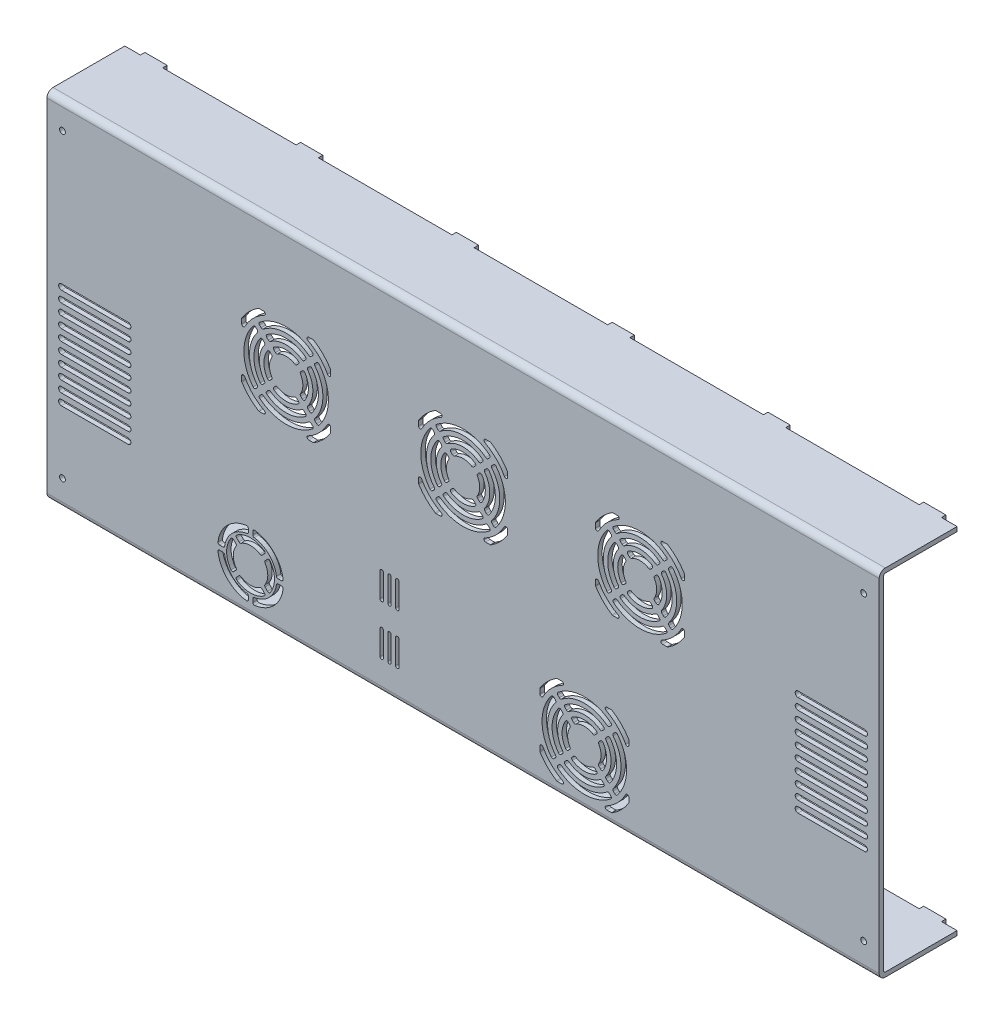
from build123d import *

# Parameters (mm, degrees)
SKETCH_1_W                         = 748
SKETCH_1_H                         = 310.5
EXTRUDE_1_DEPTH                    = 4
CUT_EXTRUDE_1_DEPTH                = 405.962421096
FILLET_3_R                         = 1.5
PATTERN_LINEAR_1_COUNT             = 2
PATTERN_LINEAR_1_PITCH             = 159
FILLET_3_OF_PATTERN_LINEAR_1_R     = 1.5
PATTERN_LINEAR_1_COL_COUNT         = 2
PATTERN_LINEAR_1_COL_PITCH         = 159
FILLET_3_OF_PATTERN_LINEAR_1_COL_R = 1.5
PATTERN_START                      = -1
PATTERN_SKETCH_1_DEPTH             = 6
CUT_EXTRUDE_2_DEPTH                = 405.962421096
FILLET_4_R                         = 1.5
CUT_EXTRUDE_3_DEPTH                = 405.962421096
CUT_EXTRUDE_4_DEPTH                = 405.962421096
SKETCH_2_W                         = 748
SKETCH_2_H                         = 70
EXTRUDE_2_DEPTH                    = 4
SKETCH_15_W                        = 20
SKETCH_15_H                        = 4
EXTRUDE_3_DEPTH                    = 4
FILLET_1_R                         = 1.5
FILLET_2_R                         = 5.5
FILLET_1_OF_MIRROR_1_R             = 1.5
FILLET_2_OF_MIRROR_1_R             = 5.5
SKETCH_8_W                         = 12
SKETCH_8_H                         = 10.5
SKETCH_8_W_2                       = 15.04
SKETCH_8_H_2                       = 2.1
CUT_EXTRUDE_5_DEPTH                = 4
SKETCH_9_R                         = 2.6
SKETCH_9_W                         = 33.8
SKETCH_9_H                         = 25.5
CUT_EXTRUDE_6_DEPTH                = 4
FILLET_5_R                         = 4.5
SKETCH_13_R                        = 2.6
CUT_EXTRUDE_8_DEPTH                = 414.173767923
SKETCH_17_R                        = 11.1
SKETCH_17_R_2                      = 1.6
CUT_EXTRUDE_9_DEPTH                = 4


with BuildPart() as part:
    # Эскиз1 → Бобышка-Вытянуть1 (new body)
    with BuildSketch(Plane.XY):
        Rectangle(SKETCH_1_W, SKETCH_1_H)
    extrude(amount=EXTRUDE_1_DEPTH)

    # Эскиз3 → Вырез-Вытянуть1 (cut, through all)
    with BuildSketch(Plane.XY.offset(4)):
        with BuildLine():
            Line((-28.579611351, 70.294077445), (-25.03523351, 66.749699604))
            ThreePointArc((-25.03523351, 66.749699604), (-33, 45.25), (-25.03523351, 23.750300396))
            Line((-25.03523351, 23.750300396), (-28.579611351, 20.205922555))
            ThreePointArc((-28.579611351, 20.205922555), (-38, 45.25), (-28.579611351, 70.294077445))
        make_face()
        with BuildLine():
            Line((-12.226017285, 36.559516621), (-15.798982153, 32.986551753))
            ThreePointArc((-15.798982153, 32.986551753), (-20, 45.25), (-15.798982153, 57.513448247))
            Line((-15.798982153, 57.513448247), (-12.226017285, 53.940483379))
            ThreePointArc((-12.226017285, 53.940483379), (-15, 45.25), (-12.226017285, 36.559516621))
        make_face()
        with BuildLine():
            Line((-18.646007383, 30.139526523), (-22.197524661, 26.588009245))
            ThreePointArc((-22.197524661, 26.588009245), (-29, 45.25), (-22.197524661, 63.911990755))
            Line((-22.197524661, 63.911990755), (-18.646007383, 60.360473477))
            ThreePointArc((-18.646007383, 60.360473477), (-24, 45.25), (-18.646007383, 30.139526523))
        make_face()
        with BuildLine():
            Line((-40, 20.572074641), (-40, 32.443751525))
            ThreePointArc((-40, 32.443751525), (-35.858145634, 23.382366573), (-29.69848481, 15.55151519))
            ThreePointArc((-29.69848481, 15.55151519), (-21.867633427, 9.391854366), (-12.806248475, 5.25))
            Line((-12.806248475, 5.25), (-24.677925359, 5.25))
            ThreePointArc((-24.677925359, 5.25), (-29.152923392, 8.383930808), (-33.234018716, 12.015981284))
            ThreePointArc((-33.234018716, 12.015981284), (-36.866069192, 16.097076608), (-40, 20.572074641))
        make_face()
        with BuildLine():
            Line((-40, 58.056248475), (-40, 69.927925359))
            ThreePointArc((-40, 69.927925359), (-36.866069192, 74.402923392), (-33.234018716, 78.484018716))
            ThreePointArc((-33.234018716, 78.484018716), (-29.152923392, 82.116069192), (-24.677925359, 85.25))
            Line((-24.677925359, 85.25), (-12.806248475, 85.25))
            ThreePointArc((-12.806248475, 85.25), (-21.867633427, 81.108145634), (-29.69848481, 74.94848481))
            ThreePointArc((-29.69848481, 74.94848481), (-35.858145634, 67.117633427), (-40, 58.056248475))
        make_face()
        with BuildLine():
            Line((25.044077445, 73.829611351), (21.499699604, 70.28523351))
            ThreePointArc((21.499699604, 70.28523351), (0, 78.25), (-21.499699604, 70.28523351))
            Line((-21.499699604, 70.28523351), (-25.044077445, 73.829611351))
            ThreePointArc((-25.044077445, 73.829611351), (0, 83.25), (25.044077445, 73.829611351))
        make_face()
        with BuildLine():
            Line((12.806248475, 85.25), (24.677925359, 85.25))
            ThreePointArc((24.677925359, 85.25), (29.152923392, 82.116069192), (33.234018716, 78.484018716))
            ThreePointArc((33.234018716, 78.484018716), (36.866069192, 74.402923392), (40, 69.927925359))
            Line((40, 69.927925359), (40, 58.056248475))
            ThreePointArc((40, 58.056248475), (35.858145634, 67.117633427), (29.69848481, 74.94848481))
            ThreePointArc((29.69848481, 74.94848481), (21.867633427, 81.108145634), (12.806248475, 85.25))
        make_face()
        with BuildLine():
            Line((-15.110473477, 63.896007383), (-18.661990755, 67.447524661))
            ThreePointArc((-18.661990755, 67.447524661), (0, 74.25), (18.661990755, 67.447524661))
            Line((18.661990755, 67.447524661), (15.110473477, 63.896007383))
            ThreePointArc((15.110473477, 63.896007383), (0, 69.25), (-15.110473477, 63.896007383))
        make_face()
        with BuildLine():
            Line((-8.690483379, 57.476017285), (-12.263448247, 61.048982153))
            ThreePointArc((-12.263448247, 61.048982153), (0, 65.25), (12.263448247, 61.048982153))
            Line((12.263448247, 61.048982153), (8.690483379, 57.476017285))
            ThreePointArc((8.690483379, 57.476017285), (0, 60.25), (-8.690483379, 57.476017285))
        make_face()
        with BuildLine():
            Line((28.579611351, 20.205922555), (25.03523351, 23.750300396))
            ThreePointArc((25.03523351, 23.750300396), (33, 45.25), (25.03523351, 66.749699604))
            Line((25.03523351, 66.749699604), (28.579611351, 70.294077445))
            ThreePointArc((28.579611351, 70.294077445), (38, 45.25), (28.579611351, 20.205922555))
        make_face()
        with BuildLine():
            Line((40, 32.443751525), (40, 20.572074641))
            ThreePointArc((40, 20.572074641), (36.866069192, 16.097076608), (33.234018716, 12.015981284))
            ThreePointArc((33.234018716, 12.015981284), (29.152923392, 8.383930808), (24.677925359, 5.25))
            Line((24.677925359, 5.25), (12.806248475, 5.25))
            ThreePointArc((12.806248475, 5.25), (21.867633427, 9.391854366), (29.69848481, 15.55151519))
            ThreePointArc((29.69848481, 15.55151519), (35.858145634, 23.382366573), (40, 32.443751525))
        make_face()
        with BuildLine():
            Line((18.646007383, 60.360473477), (22.197524661, 63.911990755))
            ThreePointArc((22.197524661, 63.911990755), (29, 45.25), (22.197524661, 26.588009245))
            Line((22.197524661, 26.588009245), (18.646007383, 30.139526523))
            ThreePointArc((18.646007383, 30.139526523), (24, 45.25), (18.646007383, 60.360473477))
        make_face()
        with BuildLine():
            Line((12.226017285, 53.940483379), (15.798982153, 57.513448247))
            ThreePointArc((15.798982153, 57.513448247), (20, 45.25), (15.798982153, 32.986551753))
            Line((15.798982153, 32.986551753), (12.226017285, 36.559516621))
            ThreePointArc((12.226017285, 36.559516621), (15, 45.25), (12.226017285, 53.940483379))
        make_face()
        with BuildLine():
            Line((-25.044077445, 16.670388649), (-21.499699604, 20.21476649))
            ThreePointArc((-21.499699604, 20.21476649), (0, 12.25), (21.499699604, 20.21476649))
            Line((21.499699604, 20.21476649), (25.044077445, 16.670388649))
            ThreePointArc((25.044077445, 16.670388649), (0, 7.25), (-25.044077445, 16.670388649))
        make_face()
        with BuildLine():
            Line((15.110473477, 26.603992617), (18.661990755, 23.052475339))
            ThreePointArc((18.661990755, 23.052475339), (0, 16.25), (-18.661990755, 23.052475339))
            Line((-18.661990755, 23.052475339), (-15.110473477, 26.603992617))
            ThreePointArc((-15.110473477, 26.603992617), (0, 21.25), (15.110473477, 26.603992617))
        make_face()
        with BuildLine():
            Line((8.690483379, 33.023982715), (12.263448247, 29.451017847))
            ThreePointArc((12.263448247, 29.451017847), (0, 25.25), (-12.263448247, 29.451017847))
            Line((-12.263448247, 29.451017847), (-8.690483379, 33.023982715))
            ThreePointArc((-8.690483379, 33.023982715), (0, 30.25), (8.690483379, 33.023982715))
        make_face()
    cut_extrude_1 = extrude(amount=-CUT_EXTRUDE_1_DEPTH, mode=Mode.SUBTRACT)

    # Скругление3
    fillet_3_edges = [part.edges().sort_by_distance(p)[0] for p in [
        (15.110473477, 63.896007383, 2),
        (-15.110473477, 63.896007383, 2),
        (-18.661990755, 67.447524661, 2),
        (18.661990755, 67.447524661, 2),
        (-40, 69.927925359, 2),
        (-24.677925359, 85.25, 2),
        (-12.806248475, 85.25, 2),
        (-40, 58.056248475, 2),
        (24.677925359, 85.25, 2),
        (40, 69.927925359, 2),
        (40, 58.056248475, 2),
        (12.806248475, 85.25, 2),
        (-40, 20.572074641, 2),
        (-40, 32.443751525, 2),
        (-12.806248475, 5.25, 2),
        (-24.677925359, 5.25, 2),
        (-8.690483379, 33.023982715, 2),
        (8.690483379, 33.023982715, 2),
        (12.263448247, 29.451017847, 2),
        (-12.263448247, 29.451017847, 2),
        (-15.110473477, 26.603992617, 2),
        (15.110473477, 26.603992617, 2),
        (18.661990755, 23.052475339, 2),
        (-18.661990755, 23.052475339, 2),
        (-21.499699604, 20.21476649, 2),
        (21.499699604, 20.21476649, 2),
        (25.044077445, 16.670388649, 2),
        (-25.044077445, 16.670388649, 2),
        (40, 20.572074641, 2),
        (24.677925359, 5.25, 2),
        (12.806248475, 5.25, 2),
        (40, 32.443751525, 2),
        (18.646007383, 30.139526523, 2),
        (18.646007383, 60.360473477, 2),
        (22.197524661, 63.911990755, 2),
        (22.197524661, 26.588009245, 2),
        (12.226017285, 36.559516621, 2),
        (12.226017285, 53.940483379, 2),
        (15.798982153, 57.513448247, 2),
        (15.798982153, 32.986551753, 2),
        (25.03523351, 23.750300396, 2),
        (25.03523351, 66.749699604, 2),
        (28.579611351, 70.294077445, 2),
        (28.579611351, 20.205922555, 2),
        (-18.646007383, 60.360473477, 2),
        (-18.646007383, 30.139526523, 2),
        (-22.197524661, 26.588009245, 2),
        (-22.197524661, 63.911990755, 2),
        (-12.226017285, 53.940483379, 2),
        (-12.226017285, 36.559516621, 2),
        (-15.798982153, 32.986551753, 2),
        (-15.798982153, 57.513448247, 2),
        (-25.03523351, 66.749699604, 2),
        (-25.03523351, 23.750300396, 2),
        (-28.579611351, 20.205922555, 2),
        (-28.579611351, 70.294077445, 2),
        (8.690483379, 57.476017285, 2),
        (-8.690483379, 57.476017285, 2),
        (-12.263448247, 61.048982153, 2),
        (12.263448247, 61.048982153, 2),
        (21.499699604, 70.28523351, 2),
        (-21.499699604, 70.28523351, 2),
        (-25.044077445, 73.829611351, 2),
        (25.044077445, 73.829611351, 2),
    ]]
    fillet(fillet_3_edges, radius=FILLET_3_R)

    # Линейный массив1: Вырез-Вытянуть1 ×2
    with Locations(*[(i * PATTERN_LINEAR_1_PITCH, 0, 0) for i in range(1, PATTERN_LINEAR_1_COUNT)]):
        add(cut_extrude_1, mode=Mode.SUBTRACT)

    # Скругление3 of Линейный массив1
    fillet_3_of_pattern_linear_1_edges = [part.edges().sort_by_distance(p)[0] for p in [
        (174.110473477, 63.896007383, 2),
        (143.889526523, 63.896007383, 2),
        (140.338009245, 67.447524661, 2),
        (177.661990755, 67.447524661, 2),
        (119, 69.927925359, 2),
        (134.322074641, 85.25, 2),
        (146.193751525, 85.25, 2),
        (119, 58.056248475, 2),
        (183.677925359, 85.25, 2),
        (199, 69.927925359, 2),
        (199, 58.056248475, 2),
        (171.806248475, 85.25, 2),
        (119, 20.572074641, 2),
        (119, 32.443751525, 2),
        (146.193751525, 5.25, 2),
        (134.322074641, 5.25, 2),
        (150.309516621, 33.023982715, 2),
        (167.690483379, 33.023982715, 2),
        (171.263448247, 29.451017847, 2),
        (146.736551753, 29.451017847, 2),
        (143.889526523, 26.603992617, 2),
        (174.110473477, 26.603992617, 2),
        (177.661990755, 23.052475339, 2),
        (140.338009245, 23.052475339, 2),
        (137.500300396, 20.21476649, 2),
        (180.499699604, 20.21476649, 2),
        (184.044077445, 16.670388649, 2),
        (133.955922555, 16.670388649, 2),
        (199, 20.572074641, 2),
        (183.677925359, 5.25, 2),
        (171.806248475, 5.25, 2),
        (199, 32.443751525, 2),
        (177.646007383, 30.139526523, 2),
        (177.646007383, 60.360473477, 2),
        (181.197524661, 63.911990755, 2),
        (181.197524661, 26.588009245, 2),
        (171.226017285, 36.559516621, 2),
        (171.226017285, 53.940483379, 2),
        (174.798982153, 57.513448247, 2),
        (174.798982153, 32.986551753, 2),
        (184.03523351, 23.750300396, 2),
        (184.03523351, 66.749699604, 2),
        (187.579611351, 70.294077445, 2),
        (187.579611351, 20.205922555, 2),
        (140.353992617, 60.360473477, 2),
        (140.353992617, 30.139526523, 2),
        (136.802475339, 26.588009245, 2),
        (136.802475339, 63.911990755, 2),
        (146.773982715, 53.940483379, 2),
        (146.773982715, 36.559516621, 2),
        (143.201017847, 32.986551753, 2),
        (143.201017847, 57.513448247, 2),
        (133.96476649, 66.749699604, 2),
        (133.96476649, 23.750300396, 2),
        (130.420388649, 20.205922555, 2),
        (130.420388649, 70.294077445, 2),
        (167.690483379, 57.476017285, 2),
        (150.309516621, 57.476017285, 2),
        (146.736551753, 61.048982153, 2),
        (171.263448247, 61.048982153, 2),
        (180.499699604, 70.28523351, 2),
        (137.500300396, 70.28523351, 2),
        (133.955922555, 73.829611351, 2),
        (184.044077445, 73.829611351, 2),
    ]]
    fillet(fillet_3_of_pattern_linear_1_edges, radius=FILLET_3_OF_PATTERN_LINEAR_1_R)

    # Линейный массив1 col: Вырез-Вытянуть1 ×2
    with Locations(*[(-i * PATTERN_LINEAR_1_COL_PITCH, 0, 0) for i in range(1, PATTERN_LINEAR_1_COL_COUNT)]):
        add(cut_extrude_1, mode=Mode.SUBTRACT)

    # Скругление3 of Линейный массив1 col
    fillet_3_of_pattern_linear_1_col_edges = [part.edges().sort_by_distance(p)[0] for p in [
        (-143.889526523, 63.896007383, 2),
        (-174.110473477, 63.896007383, 2),
        (-177.661990755, 67.447524661, 2),
        (-140.338009245, 67.447524661, 2),
        (-199, 69.927925359, 2),
        (-183.677925359, 85.25, 2),
        (-171.806248475, 85.25, 2),
        (-199, 58.056248475, 2),
        (-134.322074641, 85.25, 2),
        (-119, 69.927925359, 2),
        (-119, 58.056248475, 2),
        (-146.193751525, 85.25, 2),
        (-199, 20.572074641, 2),
        (-199, 32.443751525, 2),
        (-171.806248475, 5.25, 2),
        (-183.677925359, 5.25, 2),
        (-167.690483379, 33.023982715, 2),
        (-150.309516621, 33.023982715, 2),
        (-146.736551753, 29.451017847, 2),
        (-171.263448247, 29.451017847, 2),
        (-174.110473477, 26.603992617, 2),
        (-143.889526523, 26.603992617, 2),
        (-140.338009245, 23.052475339, 2),
        (-177.661990755, 23.052475339, 2),
        (-180.499699604, 20.21476649, 2),
        (-137.500300396, 20.21476649, 2),
        (-133.955922555, 16.670388649, 2),
        (-184.044077445, 16.670388649, 2),
        (-119, 20.572074641, 2),
        (-134.322074641, 5.25, 2),
        (-146.193751525, 5.25, 2),
        (-119, 32.443751525, 2),
        (-140.353992617, 30.139526523, 2),
        (-140.353992617, 60.360473477, 2),
        (-136.802475339, 63.911990755, 2),
        (-136.802475339, 26.588009245, 2),
        (-146.773982715, 36.559516621, 2),
        (-146.773982715, 53.940483379, 2),
        (-143.201017847, 57.513448247, 2),
        (-143.201017847, 32.986551753, 2),
        (-133.96476649, 23.750300396, 2),
        (-133.96476649, 66.749699604, 2),
        (-130.420388649, 70.294077445, 2),
        (-130.420388649, 20.205922555, 2),
        (-177.646007383, 60.360473477, 2),
        (-177.646007383, 30.139526523, 2),
        (-181.197524661, 26.588009245, 2),
        (-181.197524661, 63.911990755, 2),
        (-171.226017285, 53.940483379, 2),
        (-171.226017285, 36.559516621, 2),
        (-174.798982153, 32.986551753, 2),
        (-174.798982153, 57.513448247, 2),
        (-184.03523351, 66.749699604, 2),
        (-184.03523351, 23.750300396, 2),
        (-187.579611351, 20.205922555, 2),
        (-187.579611351, 70.294077445, 2),
        (-150.309516621, 57.476017285, 2),
        (-167.690483379, 57.476017285, 2),
        (-171.263448247, 61.048982153, 2),
        (-146.736551753, 61.048982153, 2),
        (-137.500300396, 70.28523351, 2),
        (-180.499699604, 70.28523351, 2),
        (-184.044077445, 73.829611351, 2),
        (-133.955922555, 73.829611351, 2),
    ]]
    fillet(fillet_3_of_pattern_linear_1_col_edges, radius=FILLET_3_OF_PATTERN_LINEAR_1_COL_R)

    # Эскиз-Массив1: read off the stored shape, not the designer's step
    # Эскиз-Массив1 outline → Эскиз-Массив1 (cut)
    with BuildSketch(Plane.XY.offset(PATTERN_START)):
        with BuildLine():
            ThreePointArc((89.577476759, -122.848425124), (85, -108.75), (89.577476759, -94.651574876))
            ThreePointArc((89.577476759, -94.651574876), (89.858919505, -93.652410443), (89.424229229, -92.709763134))
            Line((89.424229229, -92.709763134), (87.993600039, -91.279133945))
            ThreePointArc((87.993600039, -91.279133945), (86.823557749, -90.843787582), (85.729282042, -91.444691978))
            ThreePointArc((85.729282042, -91.444691978), (80, -108.75), (85.729282042, -126.055308022))
            ThreePointArc((85.729282042, -126.055308022), (86.823557749, -126.656212418), (87.993600039, -126.220866055))
            Line((87.993600039, -126.220866055), (89.424229229, -124.790236866))
            ThreePointArc((89.424229229, -124.790236866), (89.858919505, -123.847589557), (89.577476759, -122.848425124))
        make_face()
        with BuildLine():
            ThreePointArc((128.422523241, -94.651574876), (133, -108.75), (128.422523241, -122.848425124))
            ThreePointArc((128.422523241, -122.848425124), (128.141080495, -123.847589557), (128.575770771, -124.790236866))
            Line((128.575770771, -124.790236866), (130.006399961, -126.220866055))
            ThreePointArc((130.006399961, -126.220866055), (131.176442251, -126.656212418), (132.270717958, -126.055308022))
            ThreePointArc((132.270717958, -126.055308022), (138, -108.75), (132.270717958, -91.444691978))
            ThreePointArc((132.270717958, -91.444691978), (131.176442251, -90.843787582), (130.006399961, -91.279133945))
            Line((130.006399961, -91.279133945), (128.575770771, -92.709763134))
            ThreePointArc((128.575770771, -92.709763134), (128.141080495, -93.652410443), (128.422523241, -94.651574876))
        make_face()
        with BuildLine():
            ThreePointArc((123.098425124, -128.172523241), (109, -132.75), (94.901574876, -128.172523241))
            ThreePointArc((94.901574876, -128.172523241), (93.902410443, -127.891080495), (92.959763134, -128.325770771))
            Line((92.959763134, -128.325770771), (91.529133945, -129.756399961))
            ThreePointArc((91.529133945, -129.756399961), (91.093787582, -130.926442251), (91.694691978, -132.020717958))
            ThreePointArc((91.694691978, -132.020717958), (109, -137.75), (126.305308022, -132.020717958))
            ThreePointArc((126.305308022, -132.020717958), (126.906212418, -130.926442251), (126.470866055, -129.756399961))
            Line((126.470866055, -129.756399961), (125.040236866, -128.325770771))
            ThreePointArc((125.040236866, -128.325770771), (124.097589557, -127.891080495), (123.098425124, -128.172523241))
        make_face()
        with BuildLine():
            ThreePointArc((94.901574876, -89.327476759), (109, -84.75), (123.098425124, -89.327476759))
            ThreePointArc((123.098425124, -89.327476759), (124.097589557, -89.608919505), (125.040236866, -89.174229229))
            Line((125.040236866, -89.174229229), (126.470866055, -87.743600039))
            ThreePointArc((126.470866055, -87.743600039), (126.906212418, -86.573557749), (126.305308022, -85.479282042))
            ThreePointArc((126.305308022, -85.479282042), (109, -79.75), (91.694691978, -85.479282042))
            ThreePointArc((91.694691978, -85.479282042), (91.093787582, -86.573557749), (91.529133945, -87.743600039))
            Line((91.529133945, -87.743600039), (92.959763134, -89.174229229))
            ThreePointArc((92.959763134, -89.174229229), (93.902410443, -89.608919505), (94.901574876, -89.327476759))
        make_face()
        with BuildLine():
            ThreePointArc((129.4717033, -82.867392635), (130.489338771, -83.18837934), (131.46289544, -82.751570654))
            Line((131.46289544, -82.751570654), (132.886180112, -81.328285982))
            ThreePointArc((132.886180112, -81.328285982), (133.323259605, -80.185309989), (132.763555006, -79.097117282))
            ThreePointArc((132.763555006, -79.097117282), (109, -70.75), (85.236444994, -79.097117282))
            ThreePointArc((85.236444994, -79.097117282), (84.676740395, -80.185309989), (85.113819888, -81.328285982))
            Line((85.113819888, -81.328285982), (86.53710456, -82.751570654))
            ThreePointArc((86.53710456, -82.751570654), (87.510661229, -83.18837934), (88.5282967, -82.867392635))
            ThreePointArc((88.5282967, -82.867392635), (109, -75.75), (129.4717033, -82.867392635))
        make_face()
        with BuildLine():
            ThreePointArc((116.718912998, -95.88849223), (117.673993732, -96.091113306), (118.55146447, -95.663001624))
            Line((118.55146447, -95.663001624), (120.004272821, -94.210193273))
            ThreePointArc((120.004272821, -94.210193273), (120.43471583, -92.986403382), (119.749851513, -91.884630379))
            ThreePointArc((119.749851513, -91.884630379), (109, -88.75), (98.250148487, -91.884630379))
            ThreePointArc((98.250148487, -91.884630379), (97.56528417, -92.986403382), (97.995727179, -94.210193273))
            Line((97.995727179, -94.210193273), (99.44853553, -95.663001624))
            ThreePointArc((99.44853553, -95.663001624), (100.326006268, -96.091113306), (101.281087002, -95.88849223))
            ThreePointArc((101.281087002, -95.88849223), (109, -93.75), (116.718912998, -95.88849223))
        make_face()
        with BuildLine():
            ThreePointArc((79.347117282, -132.513555006), (80.435309989, -133.073259605), (81.578285982, -132.636180112))
            Line((81.578285982, -132.636180112), (83.001570654, -131.21289544))
            ThreePointArc((83.001570654, -131.21289544), (83.43837934, -130.239338771), (83.117392635, -129.2217033))
            ThreePointArc((83.117392635, -129.2217033), (76, -108.75), (83.117392635, -88.2782967))
            ThreePointArc((83.117392635, -88.2782967), (83.43837934, -87.260661229), (83.001570654, -86.28710456))
            Line((83.001570654, -86.28710456), (81.578285982, -84.863819888))
            ThreePointArc((81.578285982, -84.863819888), (80.435309989, -84.426740395), (79.347117282, -84.986444994))
            ThreePointArc((79.347117282, -84.986444994), (71, -108.75), (79.347117282, -132.513555006))
        make_face()
        with BuildLine():
            ThreePointArc((92.134630379, -119.499851513), (93.236403382, -120.18471583), (94.460193273, -119.754272821))
            Line((94.460193273, -119.754272821), (95.913001624, -118.30146447))
            ThreePointArc((95.913001624, -118.30146447), (96.341113306, -117.423993732), (96.13849223, -116.468912998))
            ThreePointArc((96.13849223, -116.468912998), (94, -108.75), (96.13849223, -101.031087002))
            ThreePointArc((96.13849223, -101.031087002), (96.341113306, -100.076006268), (95.913001624, -99.19853553))
            Line((95.913001624, -99.19853553), (94.460193273, -97.745727179))
            ThreePointArc((94.460193273, -97.745727179), (93.236403382, -97.31528417), (92.134630379, -98.000148487))
            ThreePointArc((92.134630379, -98.000148487), (89, -108.75), (92.134630379, -119.499851513))
        make_face()
        with BuildLine():
            ThreePointArc((132.763555006, -138.402882718), (133.323259605, -137.314690011), (132.886180112, -136.171714018))
            Line((132.886180112, -136.171714018), (131.46289544, -134.748429346))
            ThreePointArc((131.46289544, -134.748429346), (130.489338771, -134.31162066), (129.4717033, -134.632607365))
            ThreePointArc((129.4717033, -134.632607365), (109, -141.75), (88.5282967, -134.632607365))
            ThreePointArc((88.5282967, -134.632607365), (87.510661229, -134.31162066), (86.53710456, -134.748429346))
            Line((86.53710456, -134.748429346), (85.113819888, -136.171714018))
            ThreePointArc((85.113819888, -136.171714018), (84.676740395, -137.314690011), (85.236444994, -138.402882718))
            ThreePointArc((85.236444994, -138.402882718), (109, -146.75), (132.763555006, -138.402882718))
        make_face()
        with BuildLine():
            ThreePointArc((119.749851513, -125.615369621), (120.43471583, -124.513596618), (120.004272821, -123.289806727))
            Line((120.004272821, -123.289806727), (118.55146447, -121.836998376))
            ThreePointArc((118.55146447, -121.836998376), (117.673993732, -121.408886694), (116.718912998, -121.61150777))
            ThreePointArc((116.718912998, -121.61150777), (109, -123.75), (101.281087002, -121.61150777))
            ThreePointArc((101.281087002, -121.61150777), (100.326006268, -121.408886694), (99.44853553, -121.836998376))
            Line((99.44853553, -121.836998376), (97.995727179, -123.289806727))
            ThreePointArc((97.995727179, -123.289806727), (97.56528417, -124.513596618), (98.250148487, -125.615369621))
            ThreePointArc((98.250148487, -125.615369621), (109, -128.75), (119.749851513, -125.615369621))
        make_face()
        with BuildLine():
            ThreePointArc((134.882607365, -88.2782967), (142, -108.75), (134.882607365, -129.2217033))
            ThreePointArc((134.882607365, -129.2217033), (134.56162066, -130.239338771), (134.998429346, -131.21289544))
            Line((134.998429346, -131.21289544), (136.421714018, -132.636180112))
            ThreePointArc((136.421714018, -132.636180112), (137.564690011, -133.073259605), (138.652882718, -132.513555006))
            ThreePointArc((138.652882718, -132.513555006), (147, -108.75), (138.652882718, -84.986444994))
            ThreePointArc((138.652882718, -84.986444994), (137.564690011, -84.426740395), (136.421714018, -84.863819888))
            Line((136.421714018, -84.863819888), (134.998429346, -86.28710456))
            ThreePointArc((134.998429346, -86.28710456), (134.56162066, -87.260661229), (134.882607365, -88.2782967))
        make_face()
        with BuildLine():
            ThreePointArc((125.865369621, -98.000148487), (124.763596618, -97.31528417), (123.539806727, -97.745727179))
            Line((123.539806727, -97.745727179), (122.086998376, -99.19853553))
            ThreePointArc((122.086998376, -99.19853553), (121.658886694, -100.076006268), (121.86150777, -101.031087002))
            ThreePointArc((121.86150777, -101.031087002), (124, -108.75), (121.86150777, -116.468912998))
            ThreePointArc((121.86150777, -116.468912998), (121.658886694, -117.423993732), (122.086998376, -118.30146447))
            Line((122.086998376, -118.30146447), (123.539806727, -119.754272821))
            ThreePointArc((123.539806727, -119.754272821), (124.763596618, -120.18471583), (125.865369621, -119.499851513))
            ThreePointArc((125.865369621, -119.499851513), (129, -108.75), (125.865369621, -98.000148487))
        make_face()
        with BuildLine():
            ThreePointArc((133.248711306, -148.75), (133.664736453, -148.691153384), (134.048119371, -148.519230769))
            ThreePointArc((134.048119371, -148.519230769), (142.234018716, -141.984018716), (148.769230769, -133.798119371))
            ThreePointArc((148.769230769, -133.798119371), (148.941153384, -133.414736453), (149, -132.998711306))
            Line((149, -132.998711306), (149, -128.998456731))
            ThreePointArc((149, -128.998456731), (147.859597476, -127.542197944), (146.172413793, -128.300234085))
            ThreePointArc((146.172413793, -128.300234085), (138.69848481, -138.44848481), (128.550234085, -145.922413793))
            ThreePointArc((128.550234085, -145.922413793), (127.792197944, -147.609597476), (129.248456731, -148.75))
            Line((129.248456731, -148.75), (133.248711306, -148.75))
        make_face()
        with BuildLine():
            ThreePointArc((69, -132.998711306), (69.058846616, -133.414736453), (69.230769231, -133.798119371))
            ThreePointArc((69.230769231, -133.798119371), (75.765981284, -141.984018716), (83.951880629, -148.519230769))
            ThreePointArc((83.951880629, -148.519230769), (84.335263547, -148.691153384), (84.751288694, -148.75))
            Line((84.751288694, -148.75), (88.751543269, -148.75))
            ThreePointArc((88.751543269, -148.75), (90.207802056, -147.609597476), (89.449765915, -145.922413793))
            ThreePointArc((89.449765915, -145.922413793), (79.30151519, -138.44848481), (71.827586207, -128.300234085))
            ThreePointArc((71.827586207, -128.300234085), (70.140402524, -127.542197944), (69, -128.998456731))
            Line((69, -128.998456731), (69, -132.998711306))
        make_face()
        with BuildLine():
            ThreePointArc((149, -84.501288694), (148.941153384, -84.085263547), (148.769230769, -83.701880629))
            ThreePointArc((148.769230769, -83.701880629), (142.234018716, -75.515981284), (134.048119371, -68.980769231))
            ThreePointArc((134.048119371, -68.980769231), (133.664736453, -68.808846616), (133.248711306, -68.75))
            Line((133.248711306, -68.75), (129.248456731, -68.75))
            ThreePointArc((129.248456731, -68.75), (127.792197944, -69.890402524), (128.550234085, -71.577586207))
            ThreePointArc((128.550234085, -71.577586207), (138.69848481, -79.05151519), (146.172413793, -89.199765915))
            ThreePointArc((146.172413793, -89.199765915), (147.859597476, -89.957802056), (149, -88.501543269))
            Line((149, -88.501543269), (149, -84.501288694))
        make_face()
        with BuildLine():
            ThreePointArc((84.751288694, -68.75), (84.335263547, -68.808846616), (83.951880629, -68.980769231))
            ThreePointArc((83.951880629, -68.980769231), (75.765981284, -75.515981284), (69.230769231, -83.701880629))
            ThreePointArc((69.230769231, -83.701880629), (69.058846616, -84.085263547), (69, -84.501288694))
            Line((69, -84.501288694), (69, -88.501543269))
            ThreePointArc((69, -88.501543269), (70.140402524, -89.957802056), (71.827586207, -89.199765915))
            ThreePointArc((71.827586207, -89.199765915), (79.30151519, -79.05151519), (89.449765915, -71.577586207))
            ThreePointArc((89.449765915, -71.577586207), (90.207802056, -69.890402524), (88.751543269, -68.75))
            Line((88.751543269, -68.75), (84.751288694, -68.75))
        make_face()
    extrude(amount=PATTERN_SKETCH_1_DEPTH, mode=Mode.SUBTRACT)

    # Эскиз4 → Вырез-Вытянуть2 (cut, through all)
    with BuildSketch(Plane.XY.offset(4)):
        with BuildLine():
            Line((-204.722661941, -135.101089066), (-200.454318997, -130.832746122))
            ThreePointArc((-200.454318997, -130.832746122), (-191, -134.05), (-181.545681003, -130.832746122))
            Line((-181.545681003, -130.832746122), (-177.277338059, -135.101089066))
            ThreePointArc((-177.277338059, -135.101089066), (-191, -140.05), (-204.722661941, -135.101089066))
        make_face()
        with BuildLine():
            Line((-189, -147.982125306), (-189, -141.964738948))
            ThreePointArc((-189, -141.964738948), (-174.382990642, -135.167009358), (-167.585261052, -120.55))
            Line((-167.585261052, -120.55), (-161.567874694, -120.55))
            ThreePointArc((-161.567874694, -120.55), (-170.140349955, -139.409650045), (-189, -147.982125306))
        make_face()
        with BuildLine():
            Line((-207.551089066, -132.272661941), (-203.282746122, -128.004318997))
            ThreePointArc((-203.282746122, -128.004318997), (-206.5, -118.55), (-203.282746122, -109.095681003))
            Line((-203.282746122, -109.095681003), (-207.551089066, -104.827338059))
            ThreePointArc((-207.551089066, -104.827338059), (-212.5, -118.55), (-207.551089066, -132.272661941))
        make_face()
        with BuildLine():
            Line((-193, -141.964738948), (-193, -147.982125306))
            ThreePointArc((-193, -147.982125306), (-211.859650045, -139.409650045), (-220.432125306, -120.55))
            Line((-220.432125306, -120.55), (-214.414738948, -120.55))
            ThreePointArc((-214.414738948, -120.55), (-207.617009358, -135.167009358), (-193, -141.964738948))
        make_face()
        with BuildLine():
            Line((-204.722661941, -101.998910934), (-200.454318997, -106.267253878))
            ThreePointArc((-200.454318997, -106.267253878), (-191, -103.05), (-181.545681003, -106.267253878))
            Line((-181.545681003, -106.267253878), (-177.277338059, -101.998910934))
            ThreePointArc((-177.277338059, -101.998910934), (-191, -97.05), (-204.722661941, -101.998910934))
        make_face()
        with BuildLine():
            Line((-214.414738948, -116.55), (-220.432125306, -116.55))
            ThreePointArc((-220.432125306, -116.55), (-211.859650045, -97.690349955), (-193, -89.117874694))
            Line((-193, -89.117874694), (-193, -95.135261052))
            ThreePointArc((-193, -95.135261052), (-207.617009358, -101.932990642), (-214.414738948, -116.55))
        make_face()
        with BuildLine():
            Line((-174.448910934, -104.827338059), (-178.717253878, -109.095681003))
            ThreePointArc((-178.717253878, -109.095681003), (-175.5, -118.55), (-178.717253878, -128.004318997))
            Line((-178.717253878, -128.004318997), (-174.448910934, -132.272661941))
            ThreePointArc((-174.448910934, -132.272661941), (-169.5, -118.55), (-174.448910934, -104.827338059))
        make_face()
        with BuildLine():
            Line((-189, -95.135261052), (-189, -89.117874694))
            ThreePointArc((-189, -89.117874694), (-170.140349955, -97.690349955), (-161.567874694, -116.55))
            Line((-161.567874694, -116.55), (-167.585261052, -116.55))
            ThreePointArc((-167.585261052, -116.55), (-174.382990642, -101.932990642), (-189, -95.135261052))
        make_face()
    extrude(amount=-CUT_EXTRUDE_2_DEPTH, mode=Mode.SUBTRACT)

    # Скругление4
    fillet_4_edges = [part.edges().sort_by_distance(p)[0] for p in [
        (-207.551089066, -132.272661941, 2),
        (-207.551089066, -104.827338059, 2),
        (-203.282746122, -109.095681003, 2),
        (-203.282746122, -128.004318997, 2),
        (-193, -95.135261052, 2),
        (-214.414738948, -116.55, 2),
        (-220.432125306, -116.55, 2),
        (-193, -89.117874694, 2),
        (-177.277338059, -135.101089066, 2),
        (-204.722661941, -135.101089066, 2),
        (-200.454318997, -130.832746122, 2),
        (-181.545681003, -130.832746122, 2),
        (-214.414738948, -120.55, 2),
        (-193, -141.964738948, 2),
        (-193, -147.982125306, 2),
        (-220.432125306, -120.55, 2),
        (-174.448910934, -104.827338059, 2),
        (-174.448910934, -132.272661941, 2),
        (-178.717253878, -128.004318997, 2),
        (-178.717253878, -109.095681003, 2),
        (-204.722661941, -101.998910934, 2),
        (-177.277338059, -101.998910934, 2),
        (-181.545681003, -106.267253878, 2),
        (-200.454318997, -106.267253878, 2),
        (-167.585261052, -116.55, 2),
        (-189, -95.135261052, 2),
        (-189, -89.117874694, 2),
        (-161.567874694, -116.55, 2),
        (-189, -141.964738948, 2),
        (-167.585261052, -120.55, 2),
        (-161.567874694, -120.55, 2),
        (-189, -147.982125306, 2),
    ]]
    fillet(fillet_4_edges, radius=FILLET_4_R)

    # Эскиз5 → Вырез-Вытянуть3 (cut, through all)
    with BuildSketch(Plane.XY.offset(4)):
        with BuildLine():
            Line((-64.6, -131.25), (-64.6, -109.25))
            ThreePointArc((-64.6, -109.25), (-66.1, -107.75), (-67.6, -109.25))
            Line((-67.6, -109.25), (-67.6, -131.25))
            ThreePointArc((-67.6, -131.25), (-66.1, -132.75), (-64.6, -131.25))
        make_face()
        with BuildLine():
            Line((-57.6, -131.25), (-57.6, -109.25))
            ThreePointArc((-57.6, -109.25), (-59.1, -107.75), (-60.6, -109.25))
            Line((-60.6, -109.25), (-60.6, -131.25))
            ThreePointArc((-60.6, -131.25), (-59.1, -132.75), (-57.6, -131.25))
        make_face()
        with BuildLine():
            Line((-64.6, -86.25), (-64.6, -64.25))
            ThreePointArc((-64.6, -64.25), (-66.1, -62.75), (-67.6, -64.25))
            Line((-67.6, -64.25), (-67.6, -86.25))
            ThreePointArc((-67.6, -86.25), (-66.1, -87.75), (-64.6, -86.25))
        make_face()
        with BuildLine():
            Line((-57.6, -86.25), (-57.6, -64.25))
            ThreePointArc((-57.6, -64.25), (-59.1, -62.75), (-60.6, -64.25))
            Line((-60.6, -64.25), (-60.6, -86.25))
            ThreePointArc((-60.6, -86.25), (-59.1, -87.75), (-57.6, -86.25))
        make_face()
        with BuildLine():
            Line((-71.6, -86.25), (-71.6, -64.25))
            ThreePointArc((-71.6, -64.25), (-73.1, -62.75), (-74.6, -64.25))
            Line((-74.6, -64.25), (-74.6, -86.25))
            ThreePointArc((-74.6, -86.25), (-73.1, -87.75), (-71.6, -86.25))
        make_face()
        with BuildLine():
            Line((-74.6, -109.25), (-74.6, -131.25))
            ThreePointArc((-74.6, -131.25), (-73.1, -132.75), (-71.6, -131.25))
            Line((-71.6, -131.25), (-71.6, -109.25))
            ThreePointArc((-71.6, -109.25), (-73.1, -107.75), (-74.6, -109.25))
        make_face()
    extrude(amount=-CUT_EXTRUDE_3_DEPTH, mode=Mode.SUBTRACT)

    # Эскиз7 → Вырез-Вытянуть4 (cut, through all)
    with BuildSketch(Plane.XY.offset(4)):
        with BuildLine():
            Line((301, -25.25), (361, -25.25))
            ThreePointArc((361, -25.25), (363.5, -22.75), (361, -20.25))
            Line((361, -20.25), (301, -20.25))
            ThreePointArc((301, -20.25), (298.5, -22.75), (301, -25.25))
        make_face()
        with BuildLine():
            Line((301, -35.25), (361, -35.25))
            ThreePointArc((361, -35.25), (363.5, -32.75), (361, -30.25))
            Line((361, -30.25), (301, -30.25))
            ThreePointArc((301, -30.25), (298.5, -32.75), (301, -35.25))
        make_face()
        with BuildLine():
            Line((301, -45.25), (361, -45.25))
            ThreePointArc((361, -45.25), (363.5, -42.75), (361, -40.25))
            Line((361, -40.25), (301, -40.25))
            ThreePointArc((301, -40.25), (298.5, -42.75), (301, -45.25))
        make_face()
        with BuildLine():
            Line((361, 29.75), (301, 29.75))
            ThreePointArc((301, 29.75), (298.5, 27.25), (301, 24.75))
            Line((301, 24.75), (361, 24.75))
            ThreePointArc((361, 24.75), (363.5, 27.25), (361, 29.75))
        make_face()
        with BuildLine():
            Line((301, 14.75), (361, 14.75))
            ThreePointArc((361, 14.75), (363.5, 17.25), (361, 19.75))
            Line((361, 19.75), (301, 19.75))
            ThreePointArc((301, 19.75), (298.5, 17.25), (301, 14.75))
        make_face()
        with BuildLine():
            Line((301, 4.75), (361, 4.75))
            ThreePointArc((361, 4.75), (363.5, 7.25), (361, 9.75))
            Line((361, 9.75), (301, 9.75))
            ThreePointArc((301, 9.75), (298.5, 7.25), (301, 4.75))
        make_face()
        with BuildLine():
            Line((301, -5.25), (361, -5.25))
            ThreePointArc((361, -5.25), (363.5, -2.75), (361, -0.25))
            Line((361, -0.25), (301, -0.25))
            ThreePointArc((301, -0.25), (298.5, -2.75), (301, -5.25))
        make_face()
        with BuildLine():
            Line((301, -15.25), (361, -15.25))
            ThreePointArc((361, -15.25), (363.5, -12.75), (361, -10.25))
            Line((361, -10.25), (301, -10.25))
            ThreePointArc((301, -10.25), (298.5, -12.75), (301, -15.25))
        make_face()
        with BuildLine():
            Line((-301, 15.75), (-361, 15.75))
            ThreePointArc((-361, 15.75), (-363.5, 13.25), (-361, 10.75))
            Line((-361, 10.75), (-301, 10.75))
            ThreePointArc((-301, 10.75), (-298.5, 13.25), (-301, 15.75))
        make_face()
        with BuildLine():
            Line((-301, 5.75), (-361, 5.75))
            ThreePointArc((-361, 5.75), (-363.5, 3.25), (-361, 0.75))
            Line((-361, 0.75), (-301, 0.75))
            ThreePointArc((-301, 0.75), (-298.5, 3.25), (-301, 5.75))
        make_face()
        with BuildLine():
            Line((-301, -4.25), (-361, -4.25))
            ThreePointArc((-361, -4.25), (-363.5, -6.75), (-361, -9.25))
            Line((-361, -9.25), (-301, -9.25))
            ThreePointArc((-301, -9.25), (-298.5, -6.75), (-301, -4.25))
        make_face()
        with BuildLine():
            Line((-301, -14.25), (-361, -14.25))
            ThreePointArc((-361, -14.25), (-363.5, -16.75), (-361, -19.25))
            Line((-361, -19.25), (-301, -19.25))
            ThreePointArc((-301, -19.25), (-298.5, -16.75), (-301, -14.25))
        make_face()
        with BuildLine():
            Line((-301, -24.25), (-361, -24.25))
            ThreePointArc((-361, -24.25), (-363.5, -26.75), (-361, -29.25))
            Line((-361, -29.25), (-301, -29.25))
            ThreePointArc((-301, -29.25), (-298.5, -26.75), (-301, -24.25))
        make_face()
        with BuildLine():
            Line((-301, -34.25), (-361, -34.25))
            ThreePointArc((-361, -34.25), (-363.5, -36.75), (-361, -39.25))
            Line((-361, -39.25), (-301, -39.25))
            ThreePointArc((-301, -39.25), (-298.5, -36.75), (-301, -34.25))
        make_face()
        with BuildLine():
            Line((-301, -44.25), (-361, -44.25))
            ThreePointArc((-361, -44.25), (-363.5, -46.75), (-361, -49.25))
            Line((-361, -49.25), (-301, -49.25))
            ThreePointArc((-301, -49.25), (-298.5, -46.75), (-301, -44.25))
        make_face()
        with BuildLine():
            Line((-301, -54.25), (-361, -54.25))
            ThreePointArc((-361, -54.25), (-363.5, -56.75), (-361, -59.25))
            Line((-361, -59.25), (-301, -59.25))
            ThreePointArc((-301, -59.25), (-298.5, -56.75), (-301, -54.25))
        make_face()
        with BuildLine():
            Line((-301, -64.25), (-361, -64.25))
            ThreePointArc((-361, -64.25), (-363.5, -66.75), (-361, -69.25))
            Line((-361, -69.25), (-301, -69.25))
            ThreePointArc((-301, -69.25), (-298.5, -66.75), (-301, -64.25))
        make_face()
        with BuildLine():
            Line((-301, -74.25), (-361, -74.25))
            ThreePointArc((-361, -74.25), (-363.5, -76.75), (-361, -79.25))
            Line((-361, -79.25), (-301, -79.25))
            ThreePointArc((-301, -79.25), (-298.5, -76.75), (-301, -74.25))
        make_face()
        with BuildLine():
            Line((301, -55.25), (361, -55.25))
            ThreePointArc((361, -55.25), (363.5, -52.75), (361, -50.25))
            Line((361, -50.25), (301, -50.25))
            ThreePointArc((301, -50.25), (298.5, -52.75), (301, -55.25))
        make_face()
        with BuildLine():
            Line((301, -65.25), (361, -65.25))
            ThreePointArc((361, -65.25), (363.5, -62.75), (361, -60.25))
            Line((361, -60.25), (301, -60.25))
            ThreePointArc((301, -60.25), (298.5, -62.75), (301, -65.25))
        make_face()
    extrude(amount=-CUT_EXTRUDE_4_DEPTH, mode=Mode.SUBTRACT)

    # Эскиз2 → Бобышка-Вытянуть2 (add)
    with BuildSketch(Plane(origin=(0, 155.25, 0), x_dir=(1, 0, 0), z_dir=(0, 1, 0))):
        with Locations((0, 31)):
            Rectangle(SKETCH_2_W, SKETCH_2_H)
    extrude_2 = extrude(amount=EXTRUDE_2_DEPTH)

    # Эскиз15 → Бобышка-Вытянуть3 (add)
    with BuildSketch(Plane(origin=(0, 159.25, 0), x_dir=(1, 0, 0), z_dir=(0, 1, 0))):
        with Locations((-350, 68)):
            Rectangle(SKETCH_15_W, SKETCH_15_H)
        with Locations((-210, 68)):
            Rectangle(SKETCH_15_W, SKETCH_15_H)
        with Locations((-70, 68)):
            Rectangle(SKETCH_15_W, SKETCH_15_H)
        with Locations((70, 68)):
            Rectangle(SKETCH_15_W, SKETCH_15_H)
        with Locations((210, 68)):
            Rectangle(SKETCH_15_W, SKETCH_15_H)
        with Locations((350, 68)):
            Rectangle(SKETCH_15_W, SKETCH_15_H)
    extrude_3 = extrude(amount=-EXTRUDE_3_DEPTH)

    # Скругление1
    fillet_1_edges = [part.edges().sort_by_distance(p)[0] for p in [
        (0, 155.25, 0),
    ]]
    fillet(fillet_1_edges, radius=FILLET_1_R)

    # Скругление2
    fillet_2_edges = [part.edges().sort_by_distance(p)[0] for p in [
        (0, 159.25, 4),
    ]]
    fillet(fillet_2_edges, radius=FILLET_2_R)

    # Зеркальное отражение1: Бобышка-Вытянуть2, Бобышка-Вытянуть3 across plane
    add(extrude_2.mirror(Plane.ZX))
    add(extrude_3.mirror(Plane.ZX))

    # Скругление1 of Зеркальное отражение1
    fillet_1_of_mirror_1_edges = [part.edges().sort_by_distance(p)[0] for p in [
        (0, -155.25, 0),
    ]]
    fillet(fillet_1_of_mirror_1_edges, radius=FILLET_1_OF_MIRROR_1_R)

    # Скругление2 of Зеркальное отражение1
    fillet_2_of_mirror_1_edges = [part.edges().sort_by_distance(p)[0] for p in [
        (0, -159.25, 4),
    ]]
    fillet(fillet_2_of_mirror_1_edges, radius=FILLET_2_OF_MIRROR_1_R)

    # Эскиз8 → Вырез-Вытянуть5 (cut)
    with BuildSketch(Plane.XZ.offset(159.25)):
        with Locations((82.29, -49.75)):
            Rectangle(SKETCH_8_W, SKETCH_8_H)
        with Locations((102.16, -53.95)):
            Rectangle(SKETCH_8_W_2, SKETCH_8_H_2)
    extrude(amount=-CUT_EXTRUDE_5_DEPTH, mode=Mode.SUBTRACT)

    # Эскиз9 → Вырез-Вытянуть6 (cut)
    with BuildSketch(Plane.XZ.offset(159.25)):
        with Locations(Location((225.75, -33, 0), (0, 0, 270))):
            Circle(SKETCH_9_R)
        with Locations(Location((288.45, -33, 0), (0, 0, 270))):
            Circle(SKETCH_9_R)
        with Locations((257.1, -33)):
            Rectangle(SKETCH_9_W, SKETCH_9_H)
    extrude(amount=-CUT_EXTRUDE_6_DEPTH, mode=Mode.SUBTRACT)

    # Скругление5
    fillet_5_edges = [part.edges().sort_by_distance(p)[0] for p in [
        (274, -157.25, -45.75),
        (274, -157.25, -20.25),
        (240.2, -157.25, -20.25),
        (240.2, -157.25, -45.75),
    ]]
    fillet(fillet_5_edges, radius=FILLET_5_R)

    # Эскиз13 → Вырез-Вытянуть8 (cut, through all)
    with BuildSketch(Plane.XY.offset(4)):
        with Locations((-360, 135.25)):
            Circle(SKETCH_13_R)
        with Locations((360, 135.25)):
            Circle(SKETCH_13_R)
        with Locations((360, -135.25)):
            Circle(SKETCH_13_R)
        with Locations((-360, -135.25)):
            Circle(SKETCH_13_R)
    extrude(amount=-CUT_EXTRUDE_8_DEPTH, mode=Mode.SUBTRACT)

    # Эскиз17 → Вырез-Вытянуть9 (cut)
    with BuildSketch(Plane.XZ.offset(159.25)):
        with Locations(Location((0, -33, 0), (0, 0, 270))):
            Circle(SKETCH_17_R)
        with Locations(Location((15, -33, 0), (0, 0, 270))):
            Circle(SKETCH_17_R_2)
        with Locations(Location((0, -48, 0), (0, 0, 270))):
            Circle(SKETCH_17_R_2)
        with Locations(Location((-15, -33, 0), (0, 0, 270))):
            Circle(SKETCH_17_R_2)
        with Locations(Location((0, -18, 0), (0, 0, 270))):
            Circle(SKETCH_17_R_2)
    extrude(amount=-CUT_EXTRUDE_9_DEPTH, mode=Mode.SUBTRACT)


solid = part.part
